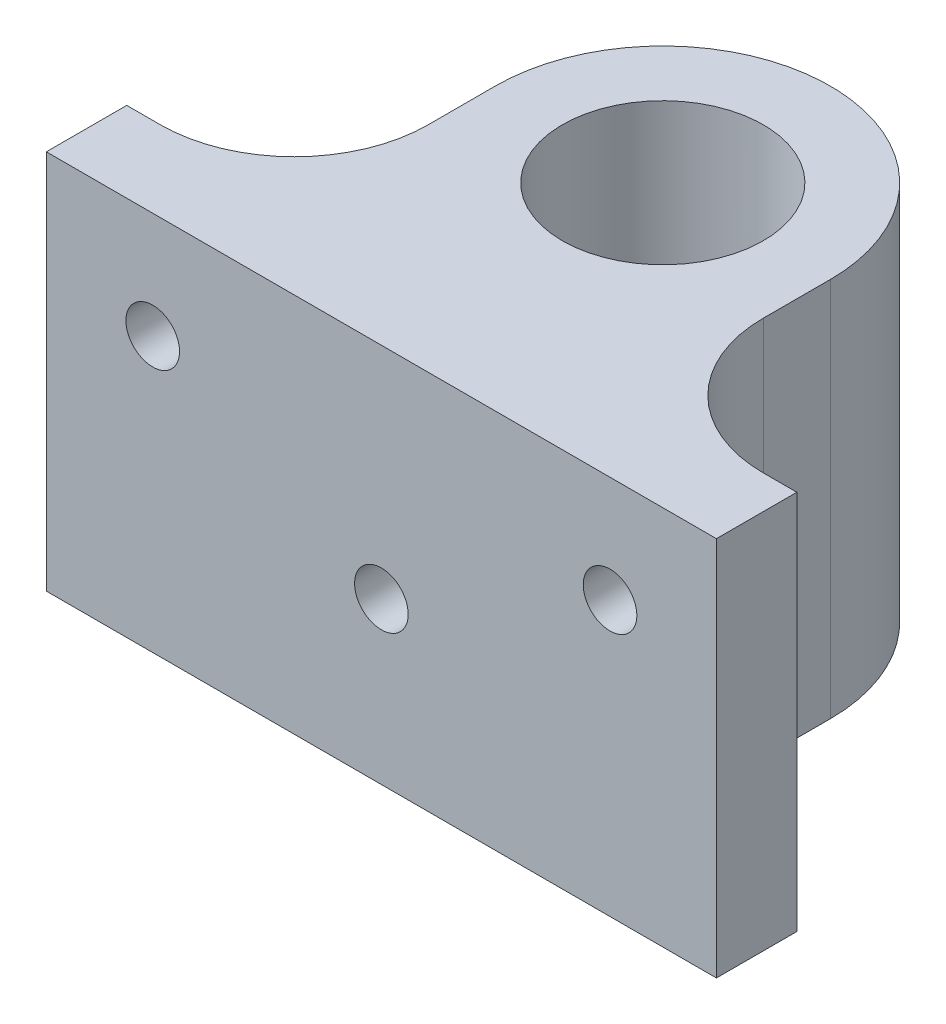
from build123d import *

# Parameters (mm, degrees)
PROFILE_SKETCH1_R                    = 7.5
PROFILE_BOSS_EXTRUDE2_DEPTH          = 28.390144
FASTENINGHOLESKETCH3_R               = 2
FASTENINGHOLECUT_EXTRUDE8_DEPTH      = 51.529696975
LM8UUFASTENINGHOLESKETCH5_R          = 2
LM8UUFASTENINGHOLECUT_EXTRUDE9_DEPTH = 51.529697031


with BuildPart() as part:
    # Profile-Sketch1 → Profile-Boss-Extrude2 (new body)
    with BuildSketch(Plane(origin=(0, 0, 0), x_dir=(1, 0, 0), z_dir=(0, 1, 0))):
        with BuildLine():
            Line((-25, -21), (25, -21))
            Line((25, -21), (25, -15))
            Line((25, -15), (22.5, -15))
            ThreePointArc((22.5, -15), (15.428932188, -12.071067812), (12.5, -5))
            Line((12.5, -5), (12.5, 0))
            ThreePointArc((12.5, 0), (0, 12.5), (-12.5, 0))
            Line((-12.5, 0), (-12.5, -5))
            ThreePointArc((-12.5, -5), (-15.428932188, -12.071067812), (-22.5, -15))
            Line((-22.5, -15), (-25, -15))
            Line((-25, -15), (-25, -21))
        make_face()
        Circle(PROFILE_SKETCH1_R, mode=Mode.SUBTRACT)
    extrude(amount=PROFILE_BOSS_EXTRUDE2_DEPTH)

    # FasteningHoleSketch3 → FasteningHoleCut-Extrude8 (cut, through all)
    with BuildSketch(Plane.XY.offset(21)):
        with Locations((-17.0625, 20.452644)):
            Circle(FASTENINGHOLESKETCH3_R)
        with Locations((17.0625, 20.452644)):
            Circle(FASTENINGHOLESKETCH3_R)
    extrude(amount=-FASTENINGHOLECUT_EXTRUDE8_DEPTH, mode=Mode.SUBTRACT)

    # LM8UUFasteningHoleSketch5 → LM8UUFasteningHoleCut-Extrude9 (cut, through all)
    with BuildSketch(Plane.XY.offset(21)):
        with Locations((0, 12)):
            Circle(LM8UUFASTENINGHOLESKETCH5_R)
    extrude(amount=-LM8UUFASTENINGHOLECUT_EXTRUDE9_DEPTH, mode=Mode.SUBTRACT)


solid = part.part
